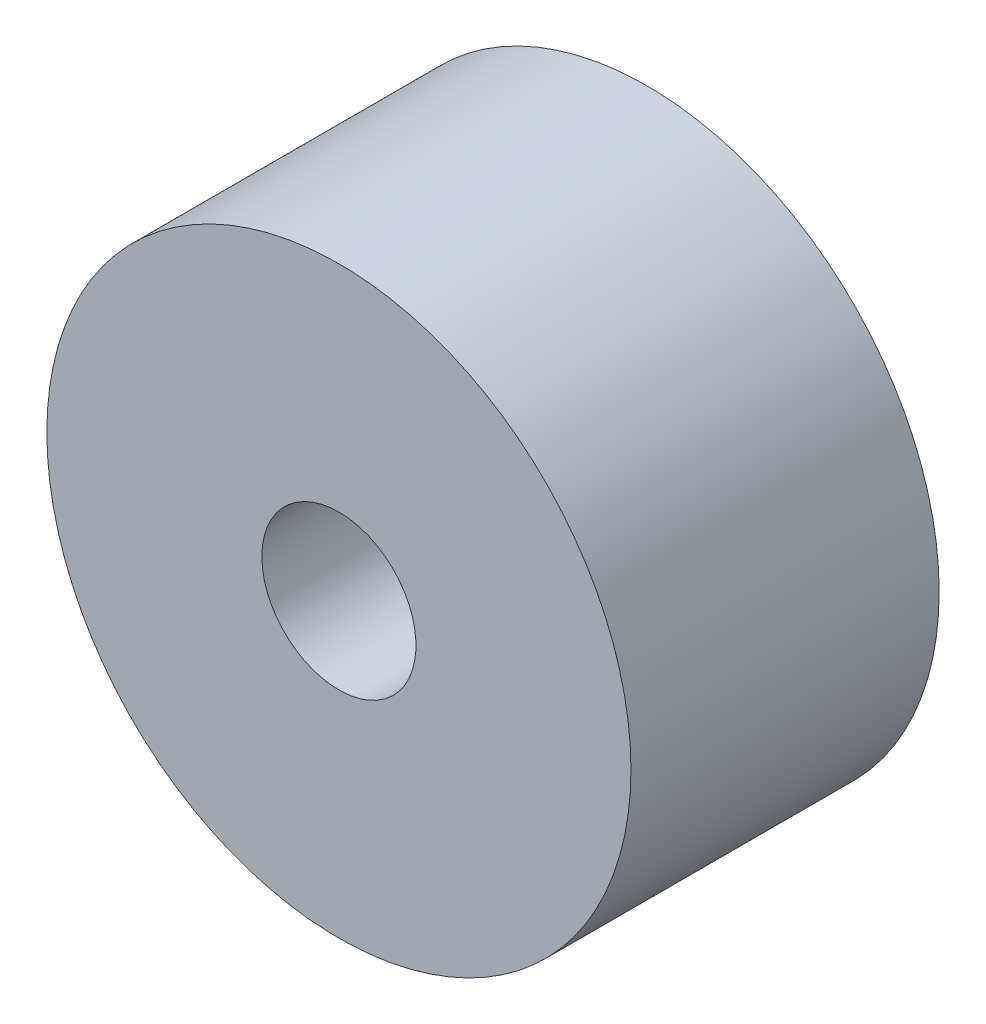
from build123d import *

# Parameters (mm, degrees)
SKETCH_1_R      = 8.15
SKETCH_1_R_2    = 2.15
EXTRUDE_1_DEPTH = 8.6
EXTRUDE_START   = 1
SKETCH_2_R      = 3.65
SKETCH_2_R_2    = 2.15
EXTRUDE_2_DEPTH = 1
CHAMFER_1_SIZE  = 1


with BuildPart() as part:
    # 草圖1 → 填料-伸長1 (new body)
    with BuildSketch(Plane.XY):
        with Locations(Location((0, 0, 0), (0, 0, 180))):
            Circle(SKETCH_1_R)
        with Locations(Location((0, 0, 0), (0, 0, 180))):
            Circle(SKETCH_1_R_2, mode=Mode.SUBTRACT)
    extrude(amount=EXTRUDE_1_DEPTH)

    # 草圖2 → 填料-伸長2 (add)
    with BuildSketch(Plane(origin=(0, 0, 0), x_dir=(-1, 0, 0), z_dir=(0, 0, -1)).offset(EXTRUDE_START)):
        with Locations(Location((0, 0, 0), (0, 0, 180))):
            Circle(SKETCH_2_R)
        Circle(SKETCH_2_R_2, mode=Mode.SUBTRACT)
    extrude(amount=-EXTRUDE_2_DEPTH)

    # 導角1
    chamfer_1_edges = [part.edges().sort_by_distance(p)[0] for p in [
        (-3.65, 0, 0),
    ]]
    chamfer(chamfer_1_edges, length=CHAMFER_1_SIZE - 0.0001)  # a hair under: the kernel refuses the full size


solid = part.part
